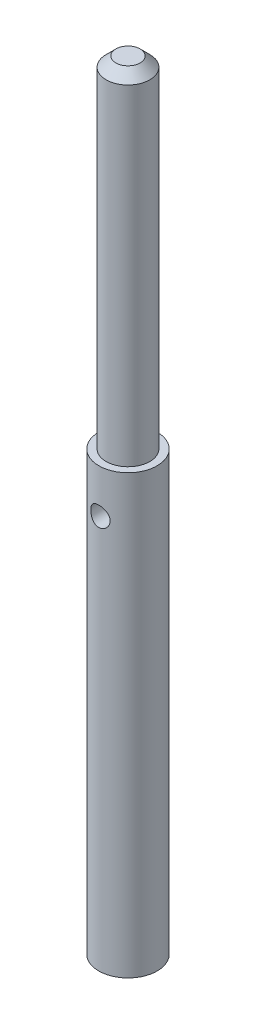
from build123d import *

# Parameters (mm, degrees)
SZKIC1_R                    = 3
DODANIE_WYCI_GNI_CIE1_DEPTH = 45
SZKIC2_R                    = 1
WYTNIJ_WYCI_GNI_CIE1_DEPTH  = 20
SZKIC9_R                    = 2.25
DODANIE_WYCI_GNI_CIE2_DEPTH = 24
SZKIC13_R                   = 2.25
DODANIE_WYCI_GNI_CIE9_DEPTH = 11
SFAZOWANIE8_SIZE            = 1


with BuildPart() as part:
    # Szkic1 → Dodanie-wyciągnięcie1 (new body)
    with BuildSketch(Plane(origin=(0, 0, 0), x_dir=(1, 0, 0), z_dir=(0, 1, 0))):
        Circle(SZKIC1_R)
    extrude(amount=DODANIE_WYCI_GNI_CIE1_DEPTH)

    # Szkic2 → Wytnij-wyciągnięcie1 (cut, symmetric)
    with BuildSketch(Plane.XY):
        with Locations((0, 40.5)):
            Circle(SZKIC2_R)
    extrude(amount=WYTNIJ_WYCI_GNI_CIE1_DEPTH, both=True, mode=Mode.SUBTRACT)

    # Szkic9 → Dodanie-wyciągnięcie2 (add)
    with BuildSketch(Plane(origin=(0, 45, 0), x_dir=(1, 0, 0), z_dir=(0, 1, 0))):
        Circle(SZKIC9_R)
    extrude(amount=DODANIE_WYCI_GNI_CIE2_DEPTH)

    # Szkic13 → Dodanie-wyciągnięcie9 (add)
    with BuildSketch(Plane(origin=(0, 69, 0), x_dir=(1, 0, 0), z_dir=(0, 1, 0))):
        Circle(SZKIC13_R)
    extrude(amount=DODANIE_WYCI_GNI_CIE9_DEPTH)

    # Sfazowanie8
    sfazowanie8_edges = [part.edges().sort_by_distance(p)[0] for p in [
        (-2.25, 80, 0),
    ]]
    chamfer(sfazowanie8_edges, length=SFAZOWANIE8_SIZE)


solid = part.part
